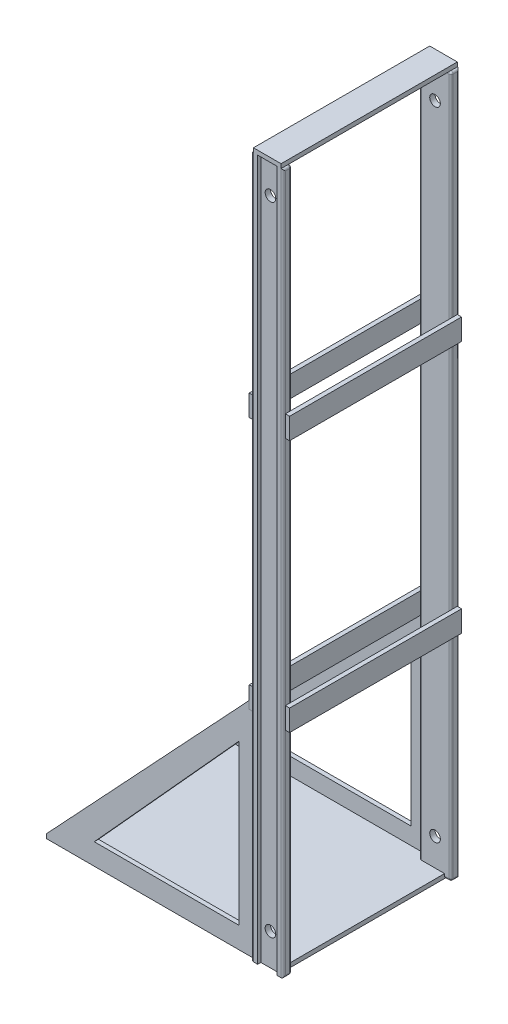
from build123d import *

# Parameters (mm, degrees)
SKETCH1_W            = 15
SKETCH1_H            = 330
SLIDER_BODY_DEPTH    = 4
SKETCH2_W            = 9
SKETCH2_H            = 330
SLIDER_INDENTS_DEPTH = 1.5
FILLET5_R            = 1
FILLET6_R            = 1
FILLET7_R            = 1
SKETCH3_R            = 2.5
CUT_EXTRUDE2_DEPTH   = 4
SKETCH5_W            = 13
SKETCH5_H            = 41.5
BOSS_EXTRUDE2_DEPTH  = 2
SKETCH7_W            = 40.5
SKETCH7_H            = 10
SKETCH7_W_2          = 41.5
BOSS_EXTRUDE3_DEPTH  = 2
SKETCH9_W            = 40.5
SKETCH9_H            = 10
SKETCH9_W_2          = 41.5
BOSS_EXTRUDE4_DEPTH  = 2
FILLET5_OF_MIRROR4_R = 1
FILLET6_OF_MIRROR4_R = 1
FILLET7_OF_MIRROR4_R = 1
SKETCH11_W           = 110
SKETCH11_H           = 2
BOSS_EXTRUDE5_DEPTH  = 83
BOSS_EXTRUDE6_DEPTH  = 2
BOSS_EXTRUDE7_DEPTH  = 2
CUT_EXTRUDE3_DEPTH   = 83


with BuildPart() as part:
    # Sketch1 → slider_body (new body)
    with BuildSketch(Plane.XY):
        with Locations((7.5, 165)):
            Rectangle(SKETCH1_W, SKETCH1_H)
    slider_body = extrude(amount=SLIDER_BODY_DEPTH)

    # Sketch2 → slider_indents (cut)
    with BuildSketch(Plane(origin=(0, 0, 0), x_dir=(-1, 0, 0), z_dir=(0, 0, -1))):
        with Locations((-7.5, 165)):
            Rectangle(SKETCH2_W, SKETCH2_H)
    slider_indents = extrude(amount=-SLIDER_INDENTS_DEPTH, mode=Mode.SUBTRACT)

    # Fillet5
    fillet5_edges = [part.edges().sort_by_distance(p)[0] for p in [
        (7.5, 330, 4),
        (0, 165, 4),
        (7.5, 0, 4),
        (15, 165, 4),
    ]]
    fillet(fillet5_edges, radius=FILLET5_R)

    # Fillet6
    # the kernel refuses this fillet: 1 mm, written as the material it takes off along each edge
    with BuildSketch(Plane(origin=(1, 1, 3), x_dir=(-1, 0, 0), z_dir=(0, -1, 0))) as fillet6_piece_1_section:
        Polygon((0, 0), (FILLET6_R, 0), (FILLET6_R, -FILLET6_R), (0, -FILLET6_R), align=None)
    fillet6_piece_1 = extrude(amount=FILLET6_R, mode=Mode.PRIVATE)
    fillet6_piece_1 = fillet6_piece_1 - Plane(origin=(1, 1, 3), x_dir=(0.7071067811865475, 0, -0.7071067811865475), z_dir=(0, -1, 0)) * Sphere(FILLET6_R, mode=Mode.PRIVATE)
    add(fillet6_piece_1, mode=Mode.SUBTRACT)
    with BuildSketch(Plane(origin=(1, 329, 3), x_dir=(0, 1, 0), z_dir=(-1, 0, 0))) as fillet6_piece_2_section:
        Polygon((0, 0), (FILLET6_R, 0), (FILLET6_R, -FILLET6_R), (0, -FILLET6_R), align=None)
    fillet6_piece_2 = extrude(amount=FILLET6_R, mode=Mode.PRIVATE)
    fillet6_piece_2 = fillet6_piece_2 - Plane(origin=(1, 329, 3), x_dir=(0, -0.7071067811865475, -0.7071067811865475), z_dir=(-1, 0, 0)) * Sphere(FILLET6_R, mode=Mode.PRIVATE)
    add(fillet6_piece_2, mode=Mode.SUBTRACT)
    with BuildSketch(Plane(origin=(0, 0, -2.5), x_dir=(1, 0, 0), z_dir=(0, 0, 1)), Plane(origin=(0, 330, -2.5), x_dir=(0, -1, 0), z_dir=(0, 0, 1))) as fillet6_piece_3:
        with BuildLine():
            CenterArc((FILLET6_R, FILLET6_R), FILLET6_R, 180, 90)
            Line((0, FILLET6_R), (0, 0))
            Line((0, 0), (FILLET6_R, 0))
        make_face()
    extrude(amount=5.5, mode=Mode.SUBTRACT)
    with BuildSketch(Plane(origin=(0, 332.5, 0), x_dir=(0, 0, 1), z_dir=(0, -1, 0))) as fillet6_piece_4:
        with BuildLine():
            CenterArc((FILLET6_R, -FILLET6_R), FILLET6_R, 90, 90)
            Line((0, -FILLET6_R), (0, 0))
            Line((0, 0), (FILLET6_R, 0))
        make_face()
    extrude(amount=335, mode=Mode.SUBTRACT)

    # Fillet7
    # the kernel refuses this fillet: 1 mm, written as the material it takes off along each edge
    with BuildSketch(Plane(origin=(14, 1, 3), x_dir=(1, 0, 0), z_dir=(0, -1, 0))) as fillet7_piece_1_section:
        Polygon((0, 0), (FILLET7_R, 0), (FILLET7_R, FILLET7_R), (0, FILLET7_R), align=None)
    fillet7_piece_1 = extrude(amount=FILLET7_R, mode=Mode.PRIVATE)
    fillet7_piece_1 = fillet7_piece_1 - Plane(origin=(14, 1, 3), x_dir=(-0.7071067811865475, 0, -0.7071067811865475), z_dir=(0, -1, 0)) * Sphere(FILLET7_R, mode=Mode.PRIVATE)
    add(fillet7_piece_1, mode=Mode.SUBTRACT)
    with BuildSketch(Plane(origin=(14, 329, 3), x_dir=(0, 1, 0), z_dir=(1, 0, 0))) as fillet7_piece_2_section:
        Polygon((0, 0), (FILLET7_R, 0), (FILLET7_R, FILLET7_R), (0, FILLET7_R), align=None)
    fillet7_piece_2 = extrude(amount=FILLET7_R, mode=Mode.PRIVATE)
    fillet7_piece_2 = fillet7_piece_2 - Plane(origin=(14, 329, 3), x_dir=(0, -0.7071067811865475, -0.7071067811865475), z_dir=(1, 0, 0)) * Sphere(FILLET7_R, mode=Mode.PRIVATE)
    add(fillet7_piece_2, mode=Mode.SUBTRACT)
    with BuildSketch(Plane(origin=(15, 330, -2.5), x_dir=(0, -1, 0), z_dir=(0, 0, 1)), Plane(origin=(15, 0, -2.5), x_dir=(-1, 0, 0), z_dir=(0, 0, 1))) as fillet7_piece_3:
        with BuildLine():
            CenterArc((FILLET7_R, -FILLET7_R), FILLET7_R, 90, 90)
            Line((0, -FILLET7_R), (0, 0))
            Line((0, 0), (FILLET7_R, 0))
        make_face()
    extrude(amount=5.5, mode=Mode.SUBTRACT)
    with BuildSketch(Plane(origin=(15, -2.5, 0), x_dir=(-1, 0, 0), z_dir=(0, 1, 0))) as fillet7_piece_4:
        with BuildLine():
            CenterArc((FILLET7_R, FILLET7_R), FILLET7_R, 180, 90)
            Line((0, FILLET7_R), (0, 0))
            Line((0, 0), (FILLET7_R, 0))
        make_face()
    extrude(amount=335, mode=Mode.SUBTRACT)

    # Sketch3 → Cut-Extrude2 (cut)
    with BuildSketch(Plane(origin=(0, 0, 1.5), x_dir=(-1, 0, 0), z_dir=(0, 0, -1))):
        with Locations((-7.5, 315)):
            Circle(SKETCH3_R)
        with Locations((-7.5, 15)):
            Circle(SKETCH3_R)
    cut_extrude2 = extrude(amount=-CUT_EXTRUDE2_DEPTH, mode=Mode.SUBTRACT)

    # Sketch5 → Boss-Extrude2 (add)
    with BuildSketch(Plane(origin=(0, 330, 0), x_dir=(1, 0, 0), z_dir=(0, 1, 0))):
        with Locations((7.5, -20.75)):
            Rectangle(SKETCH5_W, SKETCH5_H)
    boss_extrude2 = extrude(amount=BOSS_EXTRUDE2_DEPTH)

    # Sketch7 → Boss-Extrude3 (add)
    with BuildSketch(Plane.ZY):
        with Locations((21.25, 225)):
            Rectangle(SKETCH7_W, SKETCH7_H)
        with Locations((21.75, 106)):
            Rectangle(SKETCH7_W_2, SKETCH7_H)
    boss_extrude3 = extrude(amount=BOSS_EXTRUDE3_DEPTH)

    # Sketch9 → Boss-Extrude4 (add)
    with BuildSketch(Plane(origin=(15, 0, 0), x_dir=(0, 0, -1), z_dir=(1, 0, 0))):
        with Locations((-21.25, 225)):
            Rectangle(SKETCH9_W, SKETCH9_H)
        with Locations((-21.75, 106)):
            Rectangle(SKETCH9_W_2, SKETCH9_H)
    boss_extrude4 = extrude(amount=BOSS_EXTRUDE4_DEPTH)


with BuildPart() as mirror4_1:
    # Mirror4: slider_body across plane
    add(slider_body.mirror(Plane(origin=(1, 332, 41.5), x_dir=(1, 0, 0), z_dir=(0, 0, -1))))

    # Mirror4 2: slider_indents, Cut-Extrude2 across plane
    add(slider_indents.mirror(Plane(origin=(1, 332, 41.5), x_dir=(1, 0, 0), z_dir=(0, 0, -1))), mode=Mode.SUBTRACT)
    add(cut_extrude2.mirror(Plane(origin=(1, 332, 41.5), x_dir=(1, 0, 0), z_dir=(0, 0, -1))), mode=Mode.SUBTRACT)

    # Fillet5 of Mirror4
    fillet5_of_mirror4_edges = [mirror4_1.edges().sort_by_distance(p)[0] for p in [
        (7.5, 330, 79),
        (0, 165, 79),
        (7.5, 0, 79),
        (15, 165, 79),
    ]]
    fillet(fillet5_of_mirror4_edges, radius=FILLET5_OF_MIRROR4_R)

    # Fillet6 of Mirror4
    # the kernel refuses this fillet: 1 mm, written as the material it takes off along each edge
    with BuildSketch(Plane(origin=(1, 1, 80), x_dir=(-1, 0, 0), z_dir=(0, -1, 0))) as fillet6_of_mirror4_piece_1_section:
        Polygon((0, 0), (FILLET6_OF_MIRROR4_R, 0), (FILLET6_OF_MIRROR4_R, FILLET6_OF_MIRROR4_R), (0, FILLET6_OF_MIRROR4_R), align=None)
    fillet6_of_mirror4_piece_1 = extrude(amount=FILLET6_OF_MIRROR4_R, mode=Mode.PRIVATE)
    fillet6_of_mirror4_piece_1 = fillet6_of_mirror4_piece_1 - Plane(origin=(1, 1, 80), x_dir=(0.7071067811865475, 0, 0.7071067811865475), z_dir=(0, -1, 0)) * Sphere(FILLET6_OF_MIRROR4_R, mode=Mode.PRIVATE)
    add(fillet6_of_mirror4_piece_1, mode=Mode.SUBTRACT)
    with BuildSketch(Plane(origin=(1, 329, 80), x_dir=(0, 1, 0), z_dir=(-1, 0, 0))) as fillet6_of_mirror4_piece_2_section:
        Polygon((0, 0), (FILLET6_OF_MIRROR4_R, 0), (FILLET6_OF_MIRROR4_R, FILLET6_OF_MIRROR4_R), (0, FILLET6_OF_MIRROR4_R), align=None)
    fillet6_of_mirror4_piece_2 = extrude(amount=FILLET6_OF_MIRROR4_R, mode=Mode.PRIVATE)
    fillet6_of_mirror4_piece_2 = fillet6_of_mirror4_piece_2 - Plane(origin=(1, 329, 80), x_dir=(0, -0.7071067811865475, 0.7071067811865475), z_dir=(-1, 0, 0)) * Sphere(FILLET6_OF_MIRROR4_R, mode=Mode.PRIVATE)
    add(fillet6_of_mirror4_piece_2, mode=Mode.SUBTRACT)
    with BuildSketch(Plane(origin=(0, 0, 85.5), x_dir=(1, 0, 0), z_dir=(0, 0, -1)), Plane(origin=(0, 330, 85.5), x_dir=(0, -1, 0), z_dir=(0, 0, -1))) as fillet6_of_mirror4_piece_3:
        with BuildLine():
            CenterArc((FILLET6_OF_MIRROR4_R, -FILLET6_OF_MIRROR4_R), FILLET6_OF_MIRROR4_R, 90, 90)
            Line((0, -FILLET6_OF_MIRROR4_R), (0, 0))
            Line((0, 0), (FILLET6_OF_MIRROR4_R, 0))
        make_face()
    extrude(amount=5.5, mode=Mode.SUBTRACT)
    with BuildSketch(Plane(origin=(0, 332.5, 83), x_dir=(0, 0, -1), z_dir=(0, -1, 0))) as fillet6_of_mirror4_piece_4:
        with BuildLine():
            CenterArc((FILLET6_OF_MIRROR4_R, FILLET6_OF_MIRROR4_R), FILLET6_OF_MIRROR4_R, 180, 90)
            Line((0, FILLET6_OF_MIRROR4_R), (0, 0))
            Line((0, 0), (FILLET6_OF_MIRROR4_R, 0))
        make_face()
    extrude(amount=335, mode=Mode.SUBTRACT)

    # Fillet7 of Mirror4
    # the kernel refuses this fillet: 1 mm, written as the material it takes off along each edge
    with BuildSketch(Plane(origin=(14, 1, 80), x_dir=(1, 0, 0), z_dir=(0, -1, 0))) as fillet7_of_mirror4_piece_1_section:
        Polygon((0, 0), (FILLET7_OF_MIRROR4_R, 0), (FILLET7_OF_MIRROR4_R, -FILLET7_OF_MIRROR4_R), (0, -FILLET7_OF_MIRROR4_R), align=None)
    fillet7_of_mirror4_piece_1 = extrude(amount=FILLET7_OF_MIRROR4_R, mode=Mode.PRIVATE)
    fillet7_of_mirror4_piece_1 = fillet7_of_mirror4_piece_1 - Plane(origin=(14, 1, 80), x_dir=(-0.7071067811865475, 0, 0.7071067811865475), z_dir=(0, -1, 0)) * Sphere(FILLET7_OF_MIRROR4_R, mode=Mode.PRIVATE)
    add(fillet7_of_mirror4_piece_1, mode=Mode.SUBTRACT)
    with BuildSketch(Plane(origin=(14, 329, 80), x_dir=(0, 1, 0), z_dir=(1, 0, 0))) as fillet7_of_mirror4_piece_2_section:
        Polygon((0, 0), (FILLET7_OF_MIRROR4_R, 0), (FILLET7_OF_MIRROR4_R, -FILLET7_OF_MIRROR4_R), (0, -FILLET7_OF_MIRROR4_R), align=None)
    fillet7_of_mirror4_piece_2 = extrude(amount=FILLET7_OF_MIRROR4_R, mode=Mode.PRIVATE)
    fillet7_of_mirror4_piece_2 = fillet7_of_mirror4_piece_2 - Plane(origin=(14, 329, 80), x_dir=(0, -0.7071067811865475, 0.7071067811865475), z_dir=(1, 0, 0)) * Sphere(FILLET7_OF_MIRROR4_R, mode=Mode.PRIVATE)
    add(fillet7_of_mirror4_piece_2, mode=Mode.SUBTRACT)
    with BuildSketch(Plane(origin=(15, 330, 85.5), x_dir=(0, -1, 0), z_dir=(0, 0, -1)), Plane(origin=(15, 0, 85.5), x_dir=(-1, 0, 0), z_dir=(0, 0, -1))) as fillet7_of_mirror4_piece_3:
        with BuildLine():
            CenterArc((FILLET7_OF_MIRROR4_R, FILLET7_OF_MIRROR4_R), FILLET7_OF_MIRROR4_R, 180, 90)
            Line((0, FILLET7_OF_MIRROR4_R), (0, 0))
            Line((0, 0), (FILLET7_OF_MIRROR4_R, 0))
        make_face()
    extrude(amount=5.5, mode=Mode.SUBTRACT)
    with BuildSketch(Plane(origin=(15, -2.5, 83), x_dir=(-1, 0, 0), z_dir=(0, 1, 0))) as fillet7_of_mirror4_piece_4:
        with BuildLine():
            CenterArc((FILLET7_OF_MIRROR4_R, -FILLET7_OF_MIRROR4_R), FILLET7_OF_MIRROR4_R, 90, 90)
            Line((0, -FILLET7_OF_MIRROR4_R), (0, 0))
            Line((0, 0), (FILLET7_OF_MIRROR4_R, 0))
        make_face()
    extrude(amount=335, mode=Mode.SUBTRACT)


with BuildPart() as mirror4_3_1:
    # Mirror4 3: Boss-Extrude2, Boss-Extrude3, Boss-Extrude4 across plane
    add(boss_extrude2.mirror(Plane(origin=(1, 332, 41.5), x_dir=(1, 0, 0), z_dir=(0, 0, -1))))
    add(boss_extrude3.mirror(Plane(origin=(1, 332, 41.5), x_dir=(1, 0, 0), z_dir=(0, 0, -1))))
    add(boss_extrude4.mirror(Plane(origin=(1, 332, 41.5), x_dir=(1, 0, 0), z_dir=(0, 0, -1))))


with BuildPart() as part_1:
    add(part.part)

    # Mirror4 united with what the copies touc: union Mirror4_1, Mirror4 3_1
    add(mirror4_1.part)
    add(mirror4_3_1.part)

    # Sketch11 → Boss-Extrude5 (add)
    with BuildSketch(Plane.XY.offset(81.5)):
        with Locations((-43, 1)):
            Rectangle(SKETCH11_W, SKETCH11_H)
    extrude(amount=-BOSS_EXTRUDE5_DEPTH)

    # Sketch13 → Boss-Extrude6 (add)
    with BuildSketch(Plane.XY.offset(81.5)):
        Polygon((-98, 2), (3, 110), (3, 0), (-98, 0), align=None)
    extrude(amount=-BOSS_EXTRUDE6_DEPTH)

    # Sketch14 → Boss-Extrude7 (add)
    with BuildSketch(Plane(origin=(0, 0, -1.5), x_dir=(-1, 0, 0), z_dir=(0, 0, -1))):
        Polygon((98, 0), (98, 2), (0, 110), (0, 0), align=None)
    extrude(amount=-BOSS_EXTRUDE7_DEPTH)

    # Sketch16 → Cut-Extrude3 (cut)
    with BuildSketch(Plane(origin=(0, 0, -1.5), x_dir=(-1, 0, 0), z_dir=(0, 0, -1))):
        Polygon((7.420460665, 85), (7.420460665, 10), (75.476016221, 10), align=None)
    extrude(amount=-CUT_EXTRUDE3_DEPTH, mode=Mode.SUBTRACT)


solid = part_1.part
